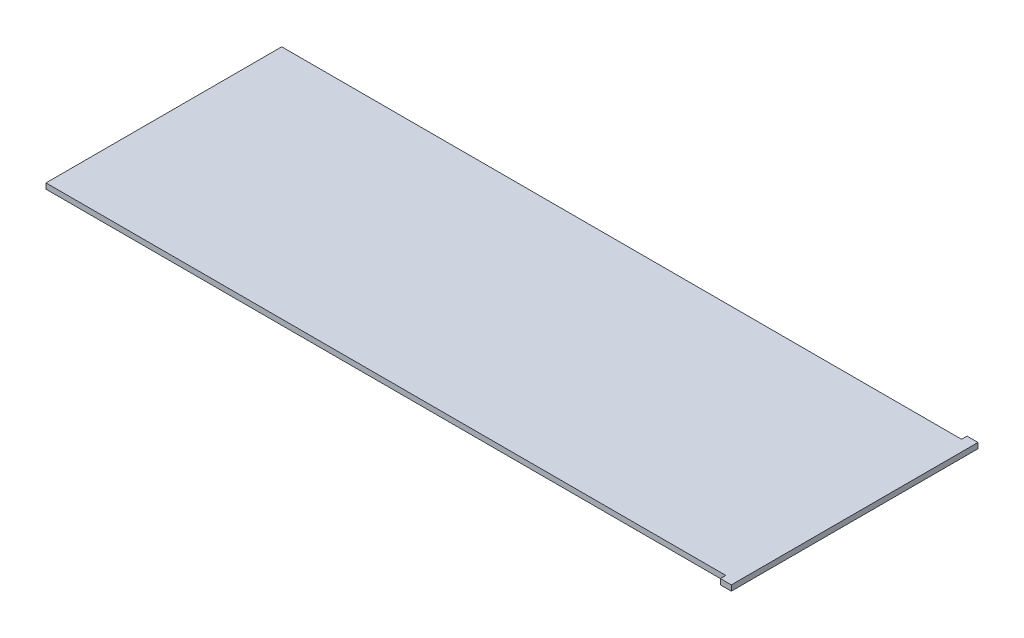
from build123d import *

# Parameters (mm, degrees)
BOSS_EXTRUDE1_DEPTH = 1.5875


with BuildPart() as part:
    # Sketch1 → Boss-Extrude1 (new, symmetric)
    with BuildSketch(Plane(origin=(0, 0, 0), x_dir=(1, 0, 0), z_dir=(0, 1, 0))):
        Polygon((200.025, 71.4375), (193.675, 71.4375), (193.675, 68.2625), (-200.025, 68.2625), (-200.025, -68.2625), (193.675, -68.2625), (193.675, -71.4375), (200.025, -71.4375), align=None)
    extrude(amount=BOSS_EXTRUDE1_DEPTH, both=True)


solid = part.part
